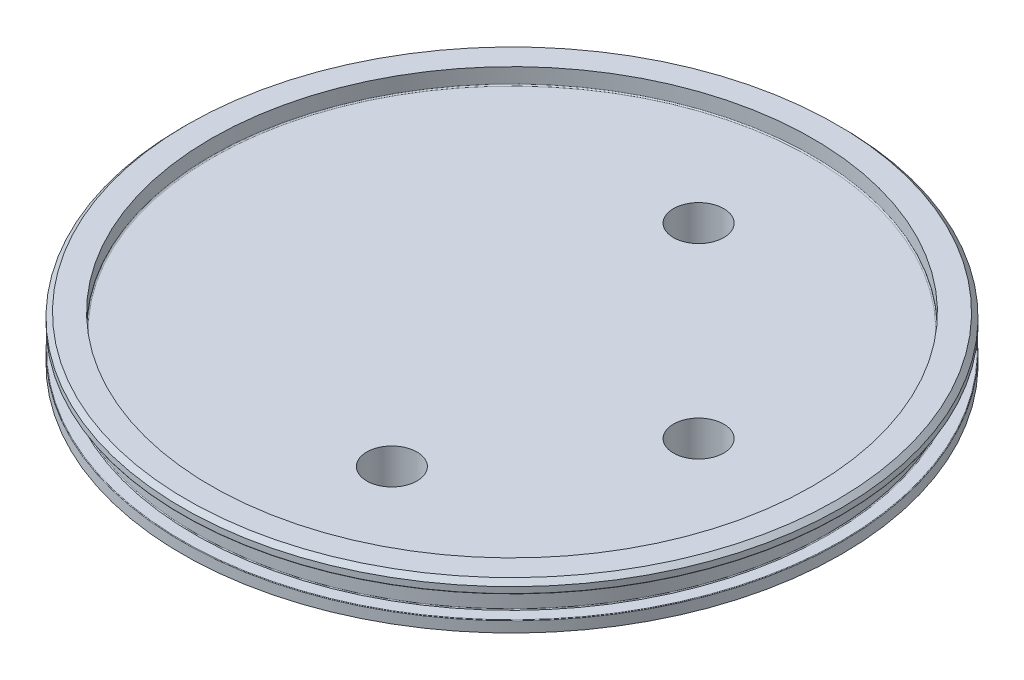
from build123d import *

# Parameters (mm, degrees)
SKETCH6_R                        = 66.04
BOSS_EXTRUDE1_DEPTH              = 2.54
PIPE_TAP_DRILL_FOR_1_4_TAP_GN2_D = 11.1252
CNC_ID_FILLET_R                  = 0.1778
CNC_OD_FILLET_R                  = 0.127
CNC_CHAMFERS_SIZE                = 1.016
CNC_BORE_FILLET_R                = 0.254


with BuildPart() as part:
    # Sketch1 → Revolve1 (revolve)
    with BuildSketch(Plane.XY):
        Polygon((0, 0), (72.898, 0), (72.898, 2.4638), (70.0532, 2.4638), (70.0532, 7.4422), (72.898, 7.4422), (72.898, 9.906), (66.548, 9.906), (66.548, 6.35), (0, 6.35), align=None)
    revolve(axis=Axis((0, 48.192213231, 0), (0, -1, 0)))

    # Sketch6 → Boss-Extrude1 (add)
    with BuildSketch(Plane.XZ):
        Circle(SKETCH6_R)
    extrude(amount=BOSS_EXTRUDE1_DEPTH)

    # Pipe Tap Drill for 1/4 Tap - GN2 (through all)
    with Locations(Plane(origin=(0, 6.35, 0), x_dir=(1, 0, 0), z_dir=(0, 1, 0))):
        with Locations((12.7, -39.272581084), (0, 41.275), (41.275, 0)):
            Hole(PIPE_TAP_DRILL_FOR_1_4_TAP_GN2_D / 2)

    # CNC ID Fillet
    cnc_id_fillet_edges = [part.edges().sort_by_distance(p)[0] for p in [
        (-70.0532, 7.4422, 0),
        (-70.0532, 2.4638, 0),
        (-66.04, 0, 0),
    ]]
    fillet(cnc_id_fillet_edges, radius=CNC_ID_FILLET_R)

    # CNC OD Fillet
    cnc_od_fillet_edges = [part.edges().sort_by_distance(p)[0] for p in [
        (-72.898, 7.4422, 0),
        (-72.898, 2.4638, 0),
        (-66.04, -2.54, 0),
    ]]
    fillet(cnc_od_fillet_edges, radius=CNC_OD_FILLET_R)

    # CNC Chamfers
    cnc_chamfers_edges = [part.edges().sort_by_distance(p)[0] for p in [
        (-72.898, 9.906, 0),
    ]]
    chamfer(cnc_chamfers_edges, length=CNC_CHAMFERS_SIZE)

    # CNC Bore Fillet
    cnc_bore_fillet_edges = [part.edges().sort_by_distance(p)[0] for p in [
        (-66.548, 6.35, 0),
    ]]
    fillet(cnc_bore_fillet_edges, radius=CNC_BORE_FILLET_R)


solid = part.part
